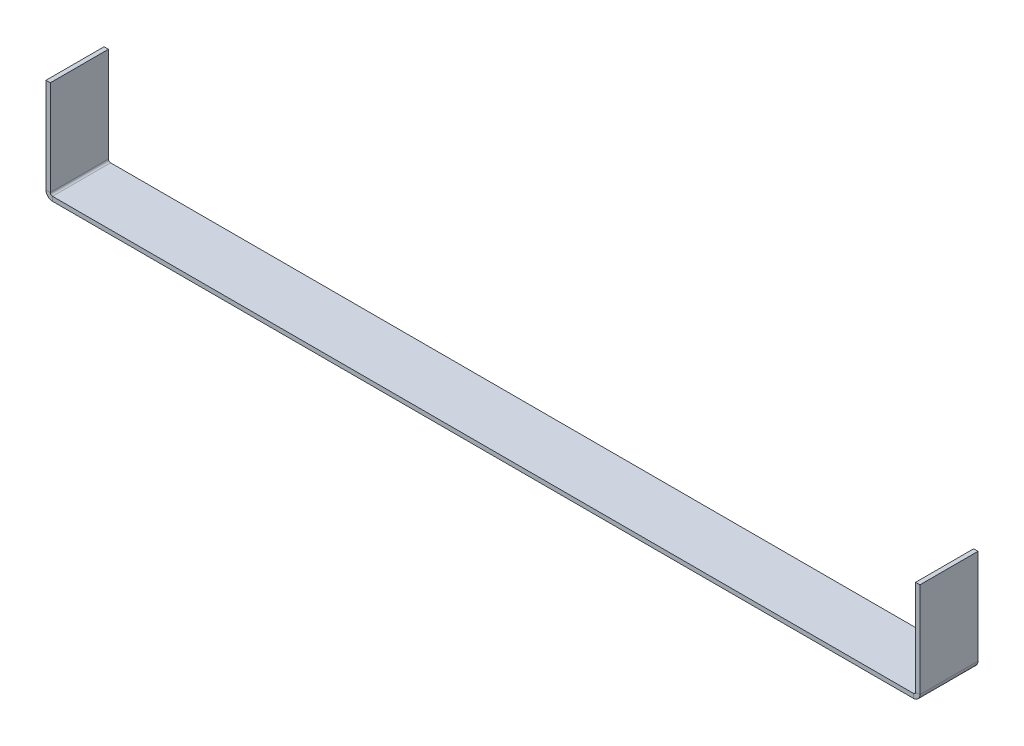
from build123d import *

# Parameters (mm, degrees)
SKETCH_1_W                       = 301
SKETCH_1_H                       = 20
SM_BASE_FLANGE_1_DEPTH           = 1.5
SM_EDGE_FLANGE_1_STRIP_W         = 7.4732
SM_EDGE_FLANGE_1_STRIP_H         = 1.5
SM_EDGE_FLANGE_1_STRIP_CUT_DEPTH = 20
SM_EDGE_FLANGE_1_DEPTH           = 20
SM_EDGE_FLANGE_2_STRIP_W         = 7.4732
SM_EDGE_FLANGE_2_STRIP_H         = 1.5
SM_EDGE_FLANGE_2_STRIP_CUT_DEPTH = 20
SM_EDGE_FLANGE_2_DEPTH           = 20


# Sheet-metal steps are written as plain solids
with BuildPart() as part:
    # Sketch 1 → Базовая кромка1 (new body)
    with BuildSketch(Plane(origin=(0, 0, 0), x_dir=(1, 0, 0), z_dir=(0, 1, 0))):
        with Locations((150.5, 10)):
            Rectangle(SKETCH_1_W, SKETCH_1_H)
    extrude(amount=-SM_BASE_FLANGE_1_DEPTH)

    # Ребро-кромка1 strip (across the edge) → Ребро-кромка1 strip cut (cut)
    with BuildSketch(Plane.XY.offset(-20)):
        with Locations((-1.5, -0.75)):
            Rectangle(SM_EDGE_FLANGE_1_STRIP_W, SM_EDGE_FLANGE_1_STRIP_H)
    extrude(amount=SM_EDGE_FLANGE_1_STRIP_CUT_DEPTH, mode=Mode.SUBTRACT)

    # Ребро-кромка1 section (across the edge) → Ребро-кромка1 (add)
    with BuildSketch(Plane.XY.offset(-20)):
        with BuildLine():
            Line((0, 0.7366), (0, 33.5))
            Line((0, 33.5), (1.5, 33.5))
            Line((1.5, 33.5), (1.5, 0.7366))
            ThreePointArc((1.5, 0.7366), (1.715745145, 0.215745145), (2.2366, 0))
            Line((2.2366, 0), (2.2366, -1.5))
            ThreePointArc((2.2366, -1.5), (0.655084973, -0.844915027), (0, 0.7366))
        make_face()
    extrude(amount=SM_EDGE_FLANGE_1_DEPTH)

    # Ребро-кромка2 strip (across the edge) → Ребро-кромка2 strip cut (cut)
    with BuildSketch(Plane(origin=(301, 0, 0), x_dir=(-1, 0, 0), z_dir=(0, 0, -1))):
        with Locations((-1.5, -0.75)):
            Rectangle(SM_EDGE_FLANGE_2_STRIP_W, SM_EDGE_FLANGE_2_STRIP_H)
    extrude(amount=SM_EDGE_FLANGE_2_STRIP_CUT_DEPTH, mode=Mode.SUBTRACT)

    # Ребро-кромка2 section (across the edge) → Ребро-кромка2 (add)
    with BuildSketch(Plane(origin=(301, 0, 0), x_dir=(-1, 0, 0), z_dir=(0, 0, -1))):
        with BuildLine():
            Line((0, 0.7366), (0, 33.5))
            Line((0, 33.5), (1.5, 33.5))
            Line((1.5, 33.5), (1.5, 0.7366))
            ThreePointArc((1.5, 0.7366), (1.715745145, 0.215745145), (2.2366, 0))
            Line((2.2366, 0), (2.2366, -1.5))
            ThreePointArc((2.2366, -1.5), (0.655084973, -0.844915027), (0, 0.7366))
        make_face()
    extrude(amount=SM_EDGE_FLANGE_2_DEPTH)


solid = part.part
